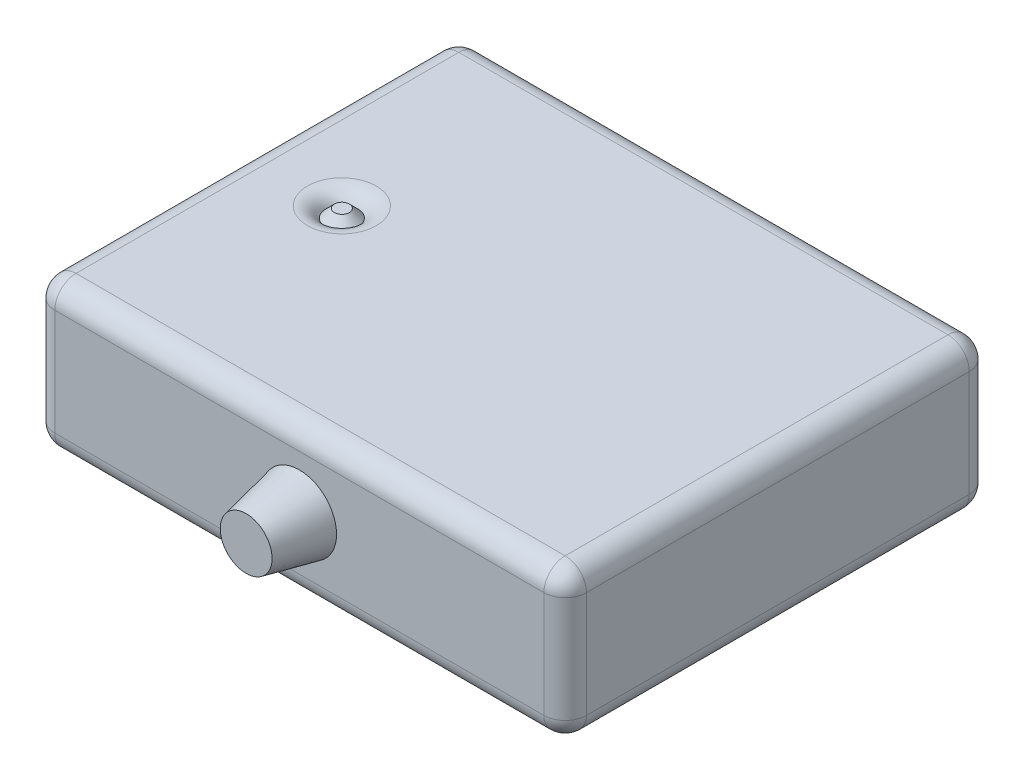
from build123d import *

# Parameters (mm, degrees)
SKETCH1_W           = 63.5
SKETCH1_H           = 50.8
BOSS_EXTRUDE1_DEPTH = 17.78
SKETCH2_R           = 4.445
BOSS_EXTRUDE2_DEPTH = 6.35
BOSS_EXTRUDE2_TAPER = 12
SKETCH3_R           = 1.905
CUT_EXTRUDE1_DEPTH  = 1.27
SKETCH4_R           = 1.905
BOSS_EXTRUDE3_DEPTH = 1.016
BOSS_EXTRUDE3_TAPER = 45
FILLET1_R           = 2.54
FILLET2_R           = 2.54


with BuildPart() as part:
    # Sketch1 → Boss-Extrude1 (new body)
    with BuildSketch(Plane(origin=(0, 0, 0), x_dir=(1, 0, 0), z_dir=(0, 1, 0))):
        Rectangle(SKETCH1_W, SKETCH1_H)
    extrude(amount=BOSS_EXTRUDE1_DEPTH)

    # Sketch3 → Cut-Extrude1 (cut)
    with BuildSketch(Plane(origin=(0, 17.78, 0), x_dir=(1, 0, 0), z_dir=(0, 1, 0))):
        with Locations(Location((-20.32, 0, 0), (0, 0, 270))):
            Circle(SKETCH3_R)
    extrude(amount=-CUT_EXTRUDE1_DEPTH, mode=Mode.SUBTRACT)

    # Sketch4 → Boss-Extrude3 (add)
    with BuildSketch(Plane(origin=(0, 16.51, 0), x_dir=(1, 0, 0), z_dir=(0, 1, 0))):
        with Locations(Location((-20.32, 0, 0), (0, 0, 270))):
            Circle(SKETCH4_R)
    extrude(amount=BOSS_EXTRUDE3_DEPTH, taper=BOSS_EXTRUDE3_TAPER)

    # Fillet1
    # the kernel refuses this fillet: 2.54 mm, written as the material it takes off along each edge
    with BuildSketch(Plane(origin=(-31.75, 17.78, 31.75), x_dir=(0, -1, 0), z_dir=(0, 0, -1)), Plane(origin=(31.75, 17.78, -31.75), x_dir=(0, -1, 0), z_dir=(0, 0, 1))) as fillet1_piece_1:
        with BuildLine():
            CenterArc((FILLET1_R, -FILLET1_R), FILLET1_R, 90, 90)
            Line((0, -FILLET1_R), (0, 0))
            Line((0, 0), (FILLET1_R, 0))
        make_face()
    extrude(amount=63.5, mode=Mode.SUBTRACT)
    with BuildSketch(Plane(origin=(38.1, 17.78, 25.4), x_dir=(0, 0, -1), z_dir=(-1, 0, 0))) as fillet1_piece_2:
        with BuildLine():
            CenterArc((FILLET1_R, FILLET1_R), FILLET1_R, 180, 90)
            Line((0, FILLET1_R), (0, 0))
            Line((0, 0), (FILLET1_R, 0))
        make_face()
    extrude(amount=76.2, mode=Mode.SUBTRACT)
    with BuildSketch(Plane(origin=(-20.32, 17.78, 0), x_dir=(0, 0, 1), z_dir=(-1, 0, 0))) as fillet1_piece_3:
        with BuildLine():
            CenterArc((4.104704526, -2.54), FILLET1_R, 90, 60)
            Line((1.905, -1.27), (1.905, 0))
            Line((1.905, 0), (4.104704526, 0))
        make_face()
    revolve(axis=Axis((-20.32, 17.78, 0), (0, 1, 0)), mode=Mode.SUBTRACT)
    with BuildSketch(Plane(origin=(-38.1, 17.78, -25.4), x_dir=(0, -1, 0), z_dir=(1, 0, 0))) as fillet1_piece_4:
        with BuildLine():
            CenterArc((FILLET1_R, -FILLET1_R), FILLET1_R, 90, 90)
            Line((0, -FILLET1_R), (0, 0))
            Line((0, 0), (FILLET1_R, 0))
        make_face()
    extrude(amount=76.2, mode=Mode.SUBTRACT)

    # Fillet2
    # the kernel refuses this fillet: 2.54 mm, written as the material it takes off along each edge
    with BuildSketch(Plane(origin=(-29.21, 15.24, -22.86), x_dir=(-1, 0, 0), z_dir=(0, 0, -1))) as fillet2_piece_1_section:
        Polygon((0, 0), (FILLET2_R, 0), (FILLET2_R, FILLET2_R), (0, FILLET2_R), align=None)
    fillet2_piece_1 = extrude(amount=FILLET2_R, mode=Mode.PRIVATE)
    fillet2_piece_1 = fillet2_piece_1 - Plane(origin=(-29.21, 15.24, -22.86), x_dir=(0.7071067811865475, -0.7071067811865475, 0), z_dir=(0, 0, -1)) * Sphere(FILLET2_R, mode=Mode.PRIVATE)
    add(fillet2_piece_1, mode=Mode.SUBTRACT)
    with BuildSketch(Plane(origin=(29.21, 15.24, -22.86), x_dir=(1, 0, 0), z_dir=(0, 0, -1))) as fillet2_piece_2_section:
        Polygon((0, 0), (FILLET2_R, 0), (FILLET2_R, -FILLET2_R), (0, -FILLET2_R), align=None)
    fillet2_piece_2 = extrude(amount=FILLET2_R, mode=Mode.PRIVATE)
    fillet2_piece_2 = fillet2_piece_2 - Plane(origin=(29.21, 15.24, -22.86), x_dir=(-0.7071067811865475, -0.7071067811865475, 0), z_dir=(0, 0, -1)) * Sphere(FILLET2_R, mode=Mode.PRIVATE)
    add(fillet2_piece_2, mode=Mode.SUBTRACT)
    with BuildSketch(Plane(origin=(-29.21, 15.24, 22.86), x_dir=(0, 0, 1), z_dir=(-1, 0, 0))) as fillet2_piece_3_section:
        Polygon((0, 0), (FILLET2_R, 0), (FILLET2_R, FILLET2_R), (0, FILLET2_R), align=None)
    fillet2_piece_3 = extrude(amount=FILLET2_R, mode=Mode.PRIVATE)
    fillet2_piece_3 = fillet2_piece_3 - Plane(origin=(-29.21, 15.24, 22.86), x_dir=(0, -0.7071067811865475, -0.7071067811865475), z_dir=(-1, 0, 0)) * Sphere(FILLET2_R, mode=Mode.PRIVATE)
    add(fillet2_piece_3, mode=Mode.SUBTRACT)
    with BuildSketch(Plane(origin=(29.21, 15.24, 22.86), x_dir=(0, 0, 1), z_dir=(1, 0, 0))) as fillet2_piece_4_section:
        Polygon((0, 0), (FILLET2_R, 0), (FILLET2_R, -FILLET2_R), (0, -FILLET2_R), align=None)
    fillet2_piece_4 = extrude(amount=FILLET2_R, mode=Mode.PRIVATE)
    fillet2_piece_4 = fillet2_piece_4 - Plane(origin=(29.21, 15.24, 22.86), x_dir=(0, -0.7071067811865475, -0.7071067811865475), z_dir=(1, 0, 0)) * Sphere(FILLET2_R, mode=Mode.PRIVATE)
    add(fillet2_piece_4, mode=Mode.SUBTRACT)
    with BuildSketch(Plane(origin=(29.21, 2.54, 22.86), x_dir=(1, 0, 0), z_dir=(0, -1, 0))) as fillet2_piece_5_section:
        Polygon((0, 0), (FILLET2_R, 0), (FILLET2_R, FILLET2_R), (0, FILLET2_R), align=None)
    fillet2_piece_5 = extrude(amount=FILLET2_R, mode=Mode.PRIVATE)
    fillet2_piece_5 = fillet2_piece_5 - Plane(origin=(29.21, 2.54, 22.86), x_dir=(-0.7071067811865475, 0, -0.7071067811865475), z_dir=(0, -1, 0)) * Sphere(FILLET2_R, mode=Mode.PRIVATE)
    add(fillet2_piece_5, mode=Mode.SUBTRACT)
    with BuildSketch(Plane(origin=(-29.21, 2.54, 22.86), x_dir=(-1, 0, 0), z_dir=(0, -1, 0))) as fillet2_piece_6_section:
        Polygon((0, 0), (FILLET2_R, 0), (FILLET2_R, -FILLET2_R), (0, -FILLET2_R), align=None)
    fillet2_piece_6 = extrude(amount=FILLET2_R, mode=Mode.PRIVATE)
    fillet2_piece_6 = fillet2_piece_6 - Plane(origin=(-29.21, 2.54, 22.86), x_dir=(0.7071067811865475, 0, -0.7071067811865477), z_dir=(0, -1, 0)) * Sphere(FILLET2_R, mode=Mode.PRIVATE)
    add(fillet2_piece_6, mode=Mode.SUBTRACT)
    with BuildSketch(Plane(origin=(-29.21, 2.54, -22.86), x_dir=(0, -1, 0), z_dir=(0, 0, -1))) as fillet2_piece_7_section:
        Polygon((0, 0), (FILLET2_R, 0), (FILLET2_R, FILLET2_R), (0, FILLET2_R), align=None)
    fillet2_piece_7 = extrude(amount=FILLET2_R, mode=Mode.PRIVATE)
    fillet2_piece_7 = fillet2_piece_7 - Plane(origin=(-29.21, 2.54, -22.86), x_dir=(0.7071067811865475, 0.7071067811865475, 0), z_dir=(0, 0, -1)) * Sphere(FILLET2_R, mode=Mode.PRIVATE)
    add(fillet2_piece_7, mode=Mode.SUBTRACT)
    with BuildSketch(Plane(origin=(29.21, 2.54, -22.86), x_dir=(0, -1, 0), z_dir=(0, 0, -1))) as fillet2_piece_8_section:
        Polygon((0, 0), (FILLET2_R, 0), (FILLET2_R, -FILLET2_R), (0, -FILLET2_R), align=None)
    fillet2_piece_8 = extrude(amount=FILLET2_R, mode=Mode.PRIVATE)
    fillet2_piece_8 = fillet2_piece_8 - Plane(origin=(29.21, 2.54, -22.86), x_dir=(-0.7071067811865475, 0.7071067811865475, 0), z_dir=(0, 0, -1)) * Sphere(FILLET2_R, mode=Mode.PRIVATE)
    add(fillet2_piece_8, mode=Mode.SUBTRACT)
    with BuildSketch(Plane(origin=(31.75, 2.54, 25.4), x_dir=(0, 0, -1), z_dir=(0, 1, 0)), Plane(origin=(31.75, 2.54, -25.4), x_dir=(-1, 0, 0), z_dir=(0, 1, 0))) as fillet2_piece_9:
        with BuildLine():
            CenterArc((FILLET2_R, FILLET2_R), FILLET2_R, 180, 90)
            Line((0, FILLET2_R), (0, 0))
            Line((0, 0), (FILLET2_R, 0))
        make_face()
    extrude(amount=12.7, mode=Mode.SUBTRACT)
    with BuildSketch(Plane(origin=(-31.75, 2.54, 25.4), x_dir=(0, 0, -1), z_dir=(0, 1, 0)), Plane(origin=(-31.75, 2.54, -25.4), x_dir=(1, 0, 0), z_dir=(0, 1, 0))) as fillet2_piece_10:
        with BuildLine():
            CenterArc((FILLET2_R, -FILLET2_R), FILLET2_R, 90, 90)
            Line((0, -FILLET2_R), (0, 0))
            Line((0, 0), (FILLET2_R, 0))
        make_face()
    extrude(amount=12.7, mode=Mode.SUBTRACT)
    with BuildSketch(Plane(origin=(29.21, 0, 25.4), x_dir=(0, 0, -1), z_dir=(-1, 0, 0))) as fillet2_piece_11:
        with BuildLine():
            CenterArc((FILLET2_R, -FILLET2_R), FILLET2_R, 90, 90)
            Line((0, -FILLET2_R), (0, 0))
            Line((0, 0), (FILLET2_R, 0))
        make_face()
    extrude(amount=58.42, mode=Mode.SUBTRACT)
    with BuildSketch(Plane(origin=(-31.75, 0, 22.86), x_dir=(1, 0, 0), z_dir=(0, 0, -1)), Plane(origin=(31.75, 0, -22.86), x_dir=(-1, 0, 0), z_dir=(0, 0, 1))) as fillet2_piece_12:
        with BuildLine():
            CenterArc((FILLET2_R, -FILLET2_R), FILLET2_R, 90, 90)
            Line((0, -FILLET2_R), (0, 0))
            Line((0, 0), (FILLET2_R, 0))
        make_face()
    extrude(amount=45.72, mode=Mode.SUBTRACT)
    with BuildSketch(Plane(origin=(-29.21, 0, -25.4), x_dir=(0, 1, 0), z_dir=(1, 0, 0))) as fillet2_piece_13:
        with BuildLine():
            CenterArc((FILLET2_R, FILLET2_R), FILLET2_R, 180, 90)
            Line((0, FILLET2_R), (0, 0))
            Line((0, 0), (FILLET2_R, 0))
        make_face()
    extrude(amount=58.42, mode=Mode.SUBTRACT)


with BuildPart() as body_2:
    # Sketch2 → Boss-Extrude2 (new body)
    with BuildSketch(Plane.XY.offset(25.4)):
        with Locations((0, 8.89)):
            Circle(SKETCH2_R)
    extrude(amount=BOSS_EXTRUDE2_DEPTH, taper=BOSS_EXTRUDE2_TAPER)


solid = Compound([part.part, body_2.part])
